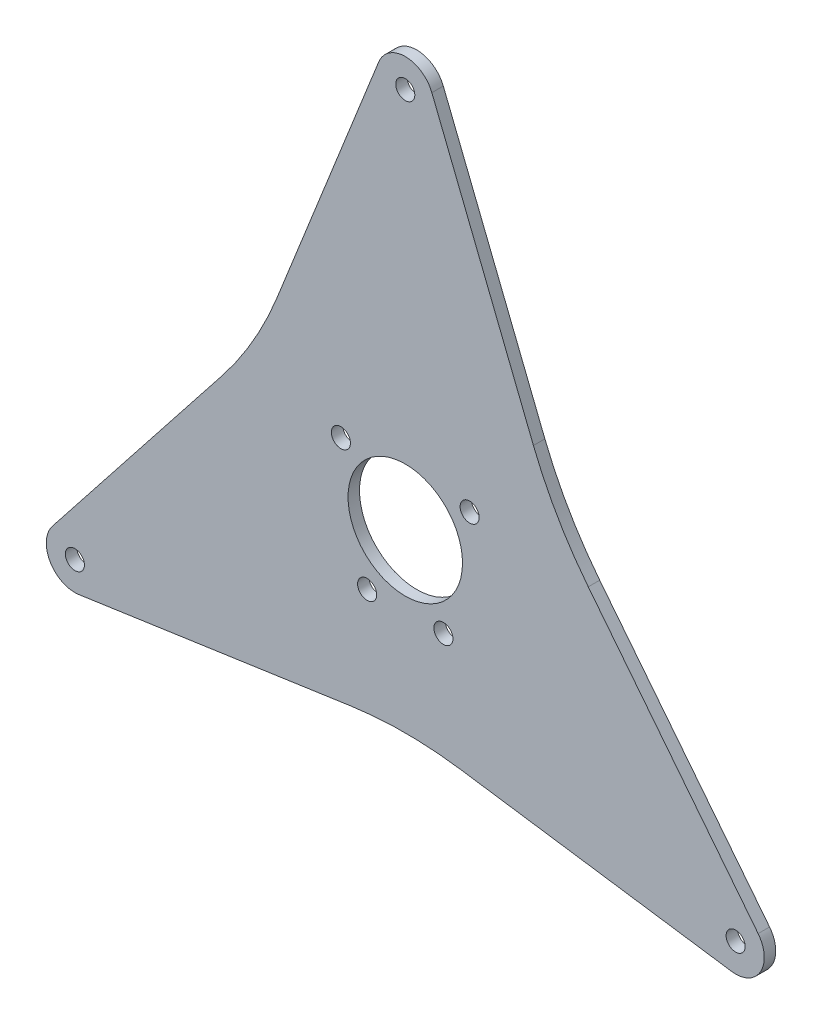
from build123d import *

# Parameters (mm, degrees)
SKETCH1_R           = 5
SKETCH1_R_2         = 30
BOSS_EXTRUDE1_DEPTH = 6


with BuildPart() as part:
    # Sketch1 → Boss-Extrude1 (new body)
    with BuildSketch(Plane.XY):
        with BuildLine():
            Line((-184.982531492, -90.710669875), (-95.932164607, 22.19158409))
            ThreePointArc((-95.932164607, 22.19158409), (-79.759760322, 46.049319093), (-67.184557876, 71.983899545))
            Line((-67.184557876, 71.983899545), (-13.93352124, 205.554906466))
            ThreePointArc((-13.93352124, 205.554906466), (0, 215), (13.93352124, 205.554906466))
            Line((13.93352124, 205.554906466), (67.184557876, 71.983899545))
            ThreePointArc((67.184557876, 71.983899545), (79.759760322, 46.049319093), (95.932164607, 22.19158409))
            Line((95.932164607, 22.19158409), (184.982531492, -90.710669875))
            ThreePointArc((184.982531492, -90.710669875), (186.195461814, -107.5), (171.049010252, -114.844236591))
            Line((171.049010252, -114.844236591), (28.747606732, -94.175483635))
            ThreePointArc((28.747606732, -94.175483635), (0, -92.098638185), (-28.747606732, -94.175483635))
            Line((-28.747606732, -94.175483635), (-171.049010252, -114.844236591))
            ThreePointArc((-171.049010252, -114.844236591), (-186.195461814, -107.5), (-184.982531492, -90.710669875))
        make_face()
        with Locations((0, 200)):
            Circle(SKETCH1_R, mode=Mode.SUBTRACT)
        with Locations((173.205080757, -100)):
            Circle(SKETCH1_R, mode=Mode.SUBTRACT)
        with Locations((-173.205080757, -100)):
            Circle(SKETCH1_R, mode=Mode.SUBTRACT)
        Circle(SKETCH1_R_2, mode=Mode.SUBTRACT)
        with Locations((-33.75, 25.061076609)):
            Circle(SKETCH1_R, mode=Mode.SUBTRACT)
        with Locations((33.75, 25.061076609)):
            Circle(SKETCH1_R, mode=Mode.SUBTRACT)
        with Locations((-20, -36.932370625)):
            Circle(SKETCH1_R, mode=Mode.SUBTRACT)
        with Locations((20, -36.932370625)):
            Circle(SKETCH1_R, mode=Mode.SUBTRACT)
    extrude(amount=BOSS_EXTRUDE1_DEPTH)


solid = part.part
